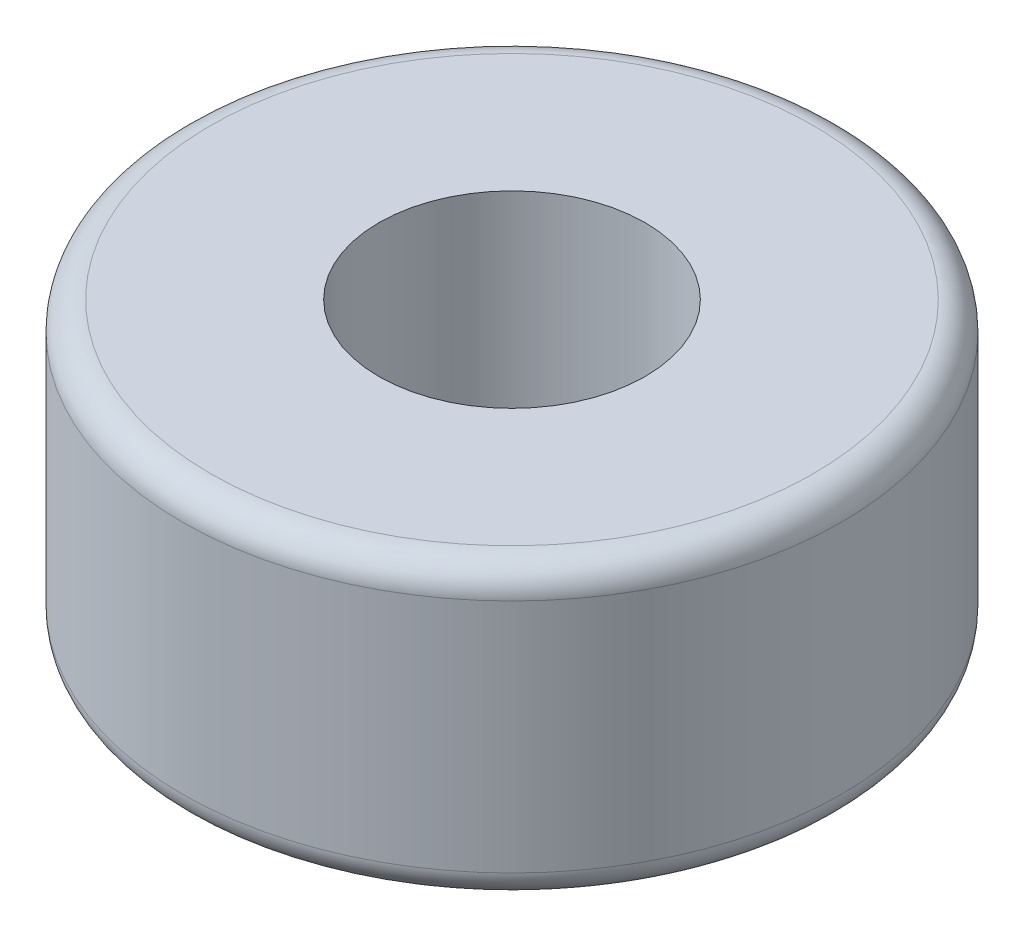
from build123d import *

# Parameters (mm, degrees)
SKETCH1_R           = 5.875
SKETCH1_R_2         = 2.375
BOSS_EXTRUDE1_DEPTH = 5.2
FILLET1_R           = 0.5


with BuildPart() as part:
    # Sketch1 → Boss-Extrude1 (new body)
    with BuildSketch(Plane(origin=(0, 0, 0), x_dir=(1, 0, 0), z_dir=(0, 1, 0))):
        Circle(SKETCH1_R)
        Circle(SKETCH1_R_2, mode=Mode.SUBTRACT)
    extrude(amount=BOSS_EXTRUDE1_DEPTH)

    # Fillet1
    fillet1_edges = [part.edges().sort_by_distance(p)[0] for p in [
        (-5.875, 0, 0),
        (-5.875, 5.2, 0),
    ]]
    fillet(fillet1_edges, radius=FILLET1_R)


solid = part.part
